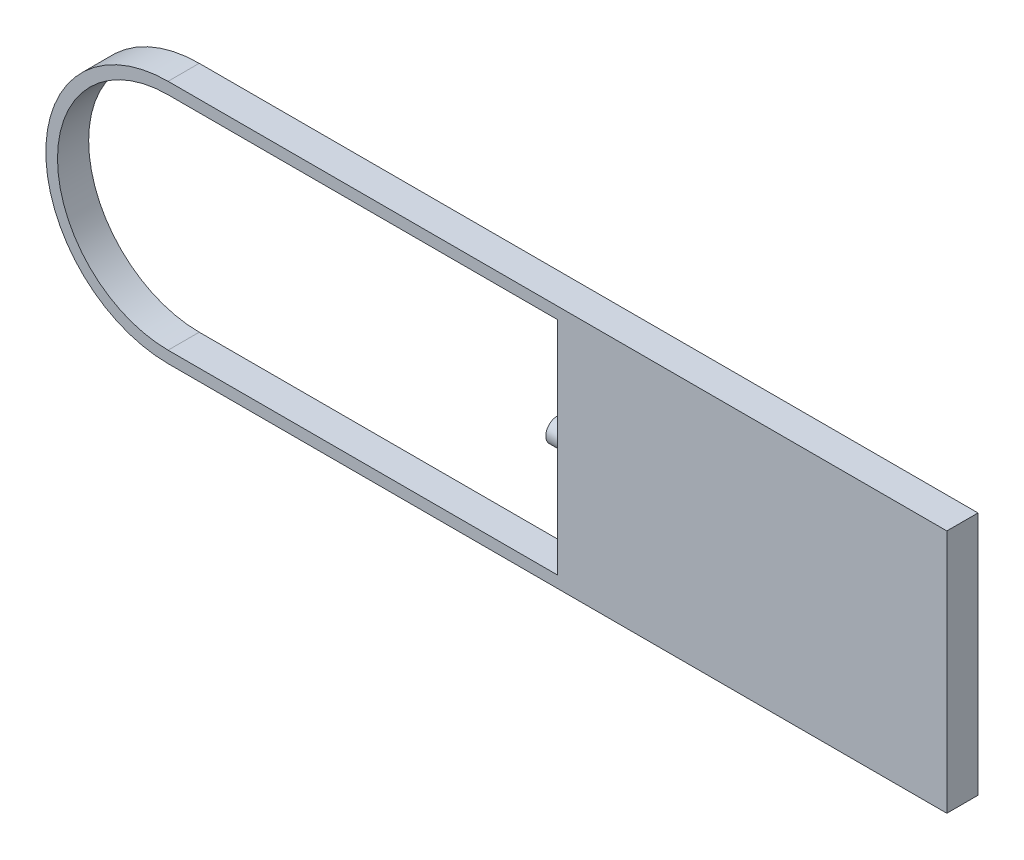
from build123d import *

# Parameters (mm, degrees)
SKETCH1_R               = 19.939
CIRCLE_EXTRUDE_DEPTH    = 5.08
SKETCH3_W               = 5.08
SKETCH3_H               = 39.878
RECTANGLE_EXTRUDE_DEPTH = 127
SKETCH2_R               = 18.034
CIRCLE_CUT_DEPTH        = 129.65601471
SKETCH6_W               = 125.095
SKETCH6_H               = 36.068
RECTANGLE_CUT_DEPTH     = 129.65601471
SKETCH7_W               = 61.595
SKETCH7_H               = 36.068
END_SHAPE_DEPTH         = 5.08
SKETCH8_R               = 1.905
BOSS_EXTRUDE1_DEPTH     = 2.54


with BuildPart() as part:
    # Sketch1 → circle extrude (new body)
    with BuildSketch(Plane.XY):
        Circle(SKETCH1_R)
    extrude(amount=CIRCLE_EXTRUDE_DEPTH)

    # Sketch3 → rectangle extrude (add)
    with BuildSketch(Plane(origin=(0, 0, 0), x_dir=(0, 0, -1), z_dir=(1, 0, 0))):
        with Locations((-2.54, 0)):
            Rectangle(SKETCH3_W, SKETCH3_H)
    extrude(amount=RECTANGLE_EXTRUDE_DEPTH)

    # Sketch2 → circle cut (cut, through all)
    with BuildSketch(Plane.XY.offset(5.08)):
        Circle(SKETCH2_R)
    extrude(amount=-CIRCLE_CUT_DEPTH, mode=Mode.SUBTRACT)

    # Sketch6 → rectangle cut (cut, through all)
    with BuildSketch(Plane.XY.offset(5.08)):
        with Locations((62.5475, 0)):
            Rectangle(SKETCH6_W, SKETCH6_H)
    extrude(amount=-RECTANGLE_CUT_DEPTH, mode=Mode.SUBTRACT)

    # Sketch7 → end shape (add)
    with BuildSketch(Plane.XY.offset(5.08)):
        with Locations((94.2975, 0)):
            Rectangle(SKETCH7_W, SKETCH7_H)
    extrude(amount=-END_SHAPE_DEPTH)

    # Sketch8 → Boss-Extrude1 (add)
    with BuildSketch(Plane.ZY.offset(-63.5)):
        with Locations((2.54, 0)):
            Circle(SKETCH8_R)
    extrude(amount=BOSS_EXTRUDE1_DEPTH)


solid = part.part
